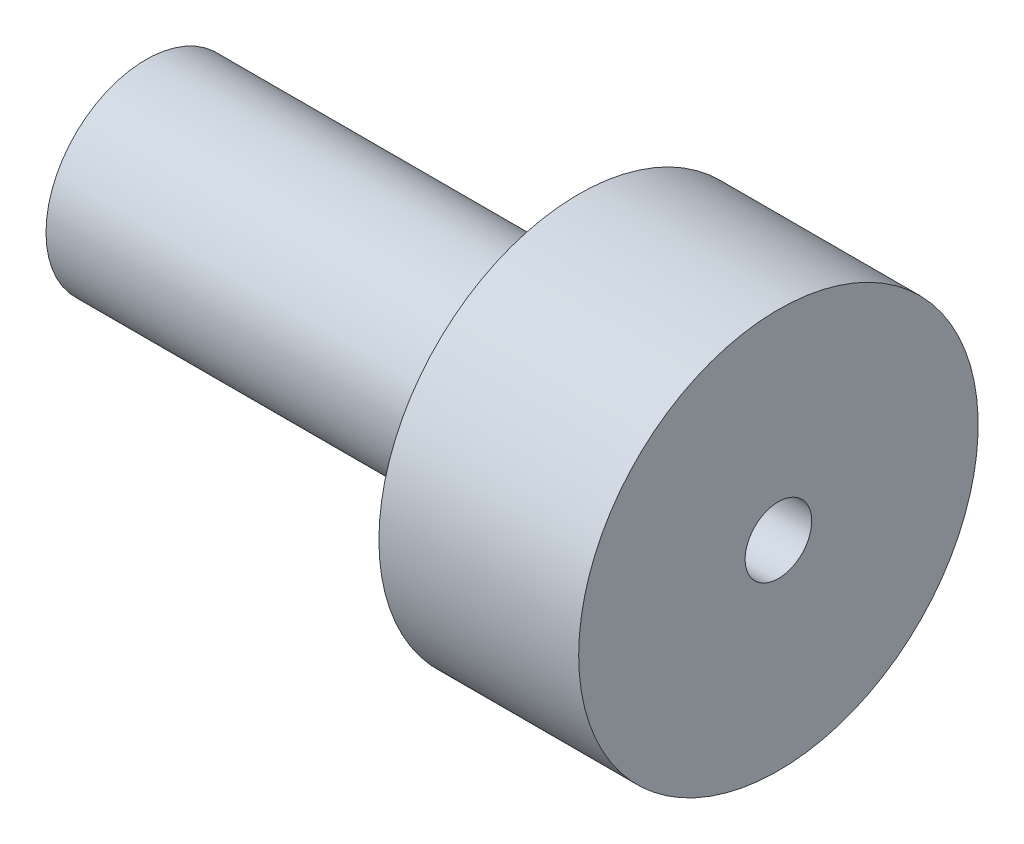
from build123d import *

# Parameters (mm, degrees)
SKETCH2_R          = 1
CUT_EXTRUDE2_DEPTH = 21.808652047


with BuildPart() as part:
    # Sketch1 → Revolve1 (revolve)
    with BuildSketch(Plane.XY):
        Polygon((0, 0), (0, 3), (13, 3), (13, 6), (19, 6), (19, 0), align=None)
    revolve(axis=Axis((-5.955223881, 0, 0), (1, 0, 0)))

    # Sketch2 → Cut-Extrude2 (cut, through all)
    with BuildSketch(Plane(origin=(0, 0, 0), x_dir=(0, 0, -1), z_dir=(1, 0, 0))):
        Circle(SKETCH2_R)
    extrude(amount=CUT_EXTRUDE2_DEPTH, mode=Mode.SUBTRACT)


solid = part.part
